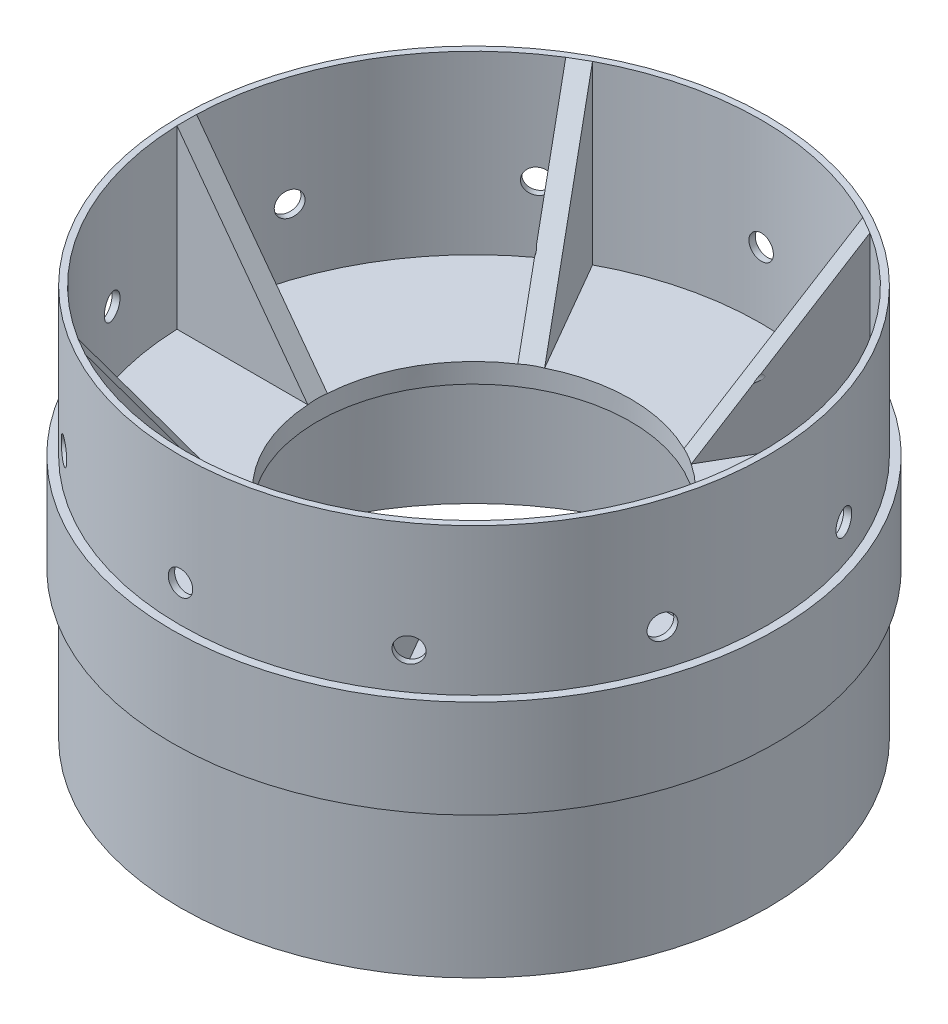
from build123d import *

# Parameters (mm, degrees)
SKETCH1_R            = 78.359
SKETCH1_R_2          = 74.549
BOSS_EXTRUDE1_DEPTH  = 25.4
SKETCH2_R            = 76.2
SKETCH2_R_2          = 74.549
BOSS_EXTRUDE2_DEPTH  = 38.1
BOSS_EXTRUDE3_START  = 38.1
SKETCH3_R            = 76.2
SKETCH3_R_2          = 74.549
BOSS_EXTRUDE3_DEPTH  = 38.1
SKETCH4_R            = 74.549
SKETCH4_R_2          = 40.64
BOSS_EXTRUDE4_DEPTH  = 5.08
BOSS_EXTRUDE10_DEPTH = 45.72
CUT_EXTRUDE1_DEPTH   = 5.08
CIRPATTERN1_COUNT    = 6
SKETCH7_R            = 3.175
CUT_EXTRUDE2_DEPTH   = 128.72045945
CIRPATTERN2_COUNT    = 10


with BuildPart() as part:
    # Sketch1 → Boss-Extrude1 (new body)
    with BuildSketch(Plane(origin=(0, 0, 0), x_dir=(1, 0, 0), z_dir=(0, 1, 0))):
        Circle(SKETCH1_R)
        Circle(SKETCH1_R_2, mode=Mode.SUBTRACT)
    extrude(amount=BOSS_EXTRUDE1_DEPTH)

    # Sketch2 → Boss-Extrude2 (add)
    with BuildSketch(Plane(origin=(0, 25.4, 0), x_dir=(1, 0, 0), z_dir=(0, 1, 0))):
        Circle(SKETCH2_R)
        Circle(SKETCH2_R_2, mode=Mode.SUBTRACT)
    extrude(amount=BOSS_EXTRUDE2_DEPTH)

    # Sketch3 → Boss-Extrude3 (add)
    with BuildSketch(Plane.XZ.offset(BOSS_EXTRUDE3_START)):
        Circle(SKETCH3_R)
        Circle(SKETCH3_R_2, mode=Mode.SUBTRACT)
    extrude(amount=-BOSS_EXTRUDE3_DEPTH)

    # Sketch4 → Boss-Extrude4 (add)
    with BuildSketch(Plane(origin=(0, 12.7, 0), x_dir=(1, 0, 0), z_dir=(0, 1, 0))):
        Circle(SKETCH4_R)
        Circle(SKETCH4_R_2, mode=Mode.SUBTRACT)
    extrude(amount=BOSS_EXTRUDE4_DEPTH)

    # Sketch5 → Boss-Extrude10 (add)
    with BuildSketch(Plane(origin=(0, 17.78, 0), x_dir=(1, 0, 0), z_dir=(0, 1, 0))):
        with BuildLine():
            Line((40.560547334, 2.54), (74.505716566, 2.54))
            ThreePointArc((74.505716566, 2.54), (74.549, 0), (74.505716566, -2.54))
            Line((74.505716566, -2.54), (40.560547334, -2.54))
            ThreePointArc((40.560547334, -2.54), (40.64, 0), (40.560547334, 2.54))
        make_face()
        with BuildLine():
            Line((22.479978192, -33.856464382), (39.452562809, -63.253843273))
            ThreePointArc((39.452562809, -63.253843273), (37.2745, -64.561327827), (35.053153757, -65.793843273))
            Line((35.053153757, -65.793843273), (18.080569141, -36.396464382))
            ThreePointArc((18.080569141, -36.396464382), (20.32, -35.19527241), (22.479978192, -33.856464382))
        make_face()
        with BuildLine():
            Line((-18.080569141, -36.396464382), (-35.053153757, -65.793843273))
            ThreePointArc((-35.053153757, -65.793843273), (-37.2745, -64.561327827), (-39.452562809, -63.253843273))
            Line((-39.452562809, -63.253843273), (-22.479978192, -33.856464382))
            ThreePointArc((-22.479978192, -33.856464382), (-20.32, -35.19527241), (-18.080569141, -36.396464382))
        make_face()
        with BuildLine():
            Line((-40.560547334, -2.54), (-74.505716566, -2.54))
            ThreePointArc((-74.505716566, -2.54), (-74.549, 0), (-74.505716566, 2.54))
            Line((-74.505716566, 2.54), (-40.560547334, 2.54))
            ThreePointArc((-40.560547334, 2.54), (-40.64, 0), (-40.560547334, -2.54))
        make_face()
        with BuildLine():
            Line((-22.479978192, 33.856464382), (-39.452562809, 63.253843273))
            ThreePointArc((-39.452562809, 63.253843273), (-37.2745, 64.561327827), (-35.053153757, 65.793843273))
            Line((-35.053153757, 65.793843273), (-18.080569141, 36.396464382))
            ThreePointArc((-18.080569141, 36.396464382), (-20.32, 35.19527241), (-22.479978192, 33.856464382))
        make_face()
        with BuildLine():
            Line((18.080569141, 36.396464382), (35.053153757, 65.793843273))
            ThreePointArc((35.053153757, 65.793843273), (37.2745, 64.561327827), (39.452562809, 63.253843273))
            Line((39.452562809, 63.253843273), (22.479978192, 33.856464382))
            ThreePointArc((22.479978192, 33.856464382), (20.32, 35.19527241), (18.080569141, 36.396464382))
        make_face()
    extrude(amount=BOSS_EXTRUDE10_DEPTH)

    # Sketch6 → Cut-Extrude1 (cut)
    with BuildSketch(Plane.XY.offset(2.54)):
        Polygon((74.505716566, 63.5), (40.560547334, 17.78), (40.560547334, 63.5), align=None)
    cut_extrude1 = extrude(amount=-CUT_EXTRUDE1_DEPTH, mode=Mode.SUBTRACT)

    # CirPattern1: Cut-Extrude1 ×6 about axis
    cirpattern1_axis = Axis((0, 12.7, 0), (0, 1, 0))
    for i in range(1, CIRPATTERN1_COUNT):
        add(cut_extrude1.rotate(cirpattern1_axis, i * 360 / CIRPATTERN1_COUNT), mode=Mode.SUBTRACT)

    # Sketch7 → Cut-Extrude2 (cut, through all)
    with BuildSketch(Plane.XY):
        with Locations((0, 34.925)):
            Circle(SKETCH7_R)
    cut_extrude2 = extrude(amount=-CUT_EXTRUDE2_DEPTH, mode=Mode.SUBTRACT)

    # CirPattern2: Cut-Extrude2 ×10 about axis
    cirpattern2_axis = Axis((0, 42.33015195, 0), (0, 1, 0))
    for i in range(1, CIRPATTERN2_COUNT):
        add(cut_extrude2.rotate(cirpattern2_axis, i * 360 / CIRPATTERN2_COUNT), mode=Mode.SUBTRACT)


solid = part.part
